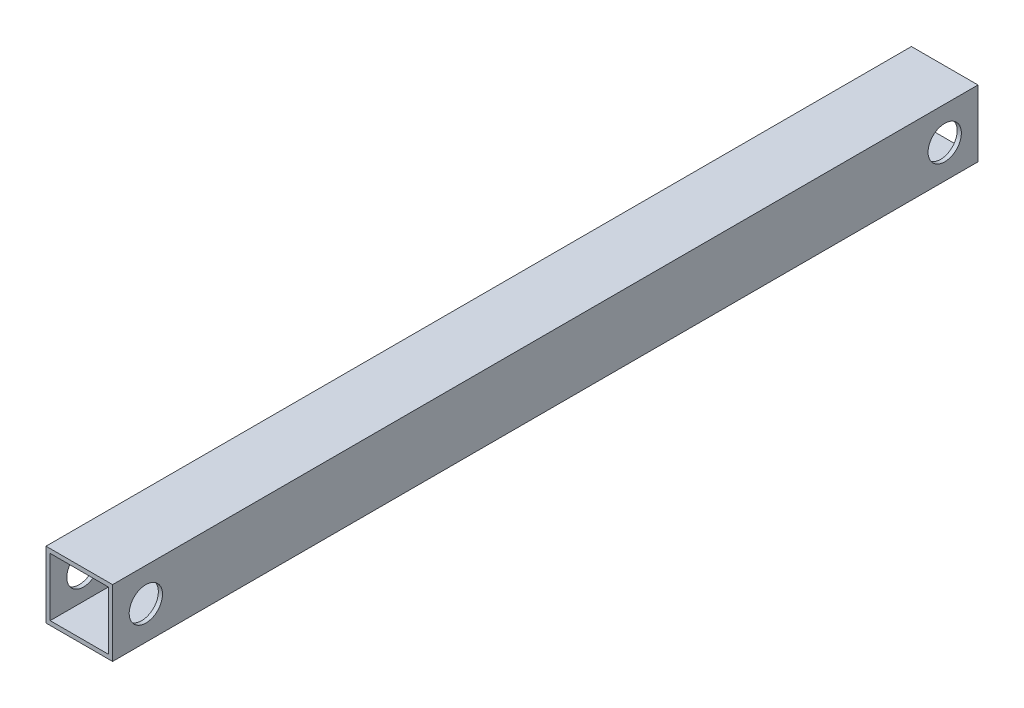
from build123d import *

# Parameters (mm, degrees)
SKETCH1_W           = 25.4
SKETCH1_H           = 25.4
SKETCH1_W_2         = 22.225
SKETCH1_H_2         = 22.225
EXTRUDE_THIN1_DEPTH = 165.1
SKETCH2_R           = 6.35
CUT_EXTRUDE1_DEPTH  = 168.52450567


with BuildPart() as part:
    # Sketch1 → Extrude-Thin1 (new, symmetric)
    with BuildSketch(Plane.XY):
        Rectangle(SKETCH1_W, SKETCH1_H)
        Rectangle(SKETCH1_W_2, SKETCH1_H_2, mode=Mode.SUBTRACT)
    extrude(amount=EXTRUDE_THIN1_DEPTH, both=True)

    # Sketch2 → Cut-Extrude1 (cut, through all)
    with BuildSketch(Plane(origin=(12.7, 0, 0), x_dir=(0, 0, -1), z_dir=(1, 0, 0))):
        with Locations((-152.4, 0)):
            Circle(SKETCH2_R)
        with Locations((152.4, 0)):
            Circle(SKETCH2_R)
    extrude(amount=-CUT_EXTRUDE1_DEPTH, mode=Mode.SUBTRACT)


solid = part.part
